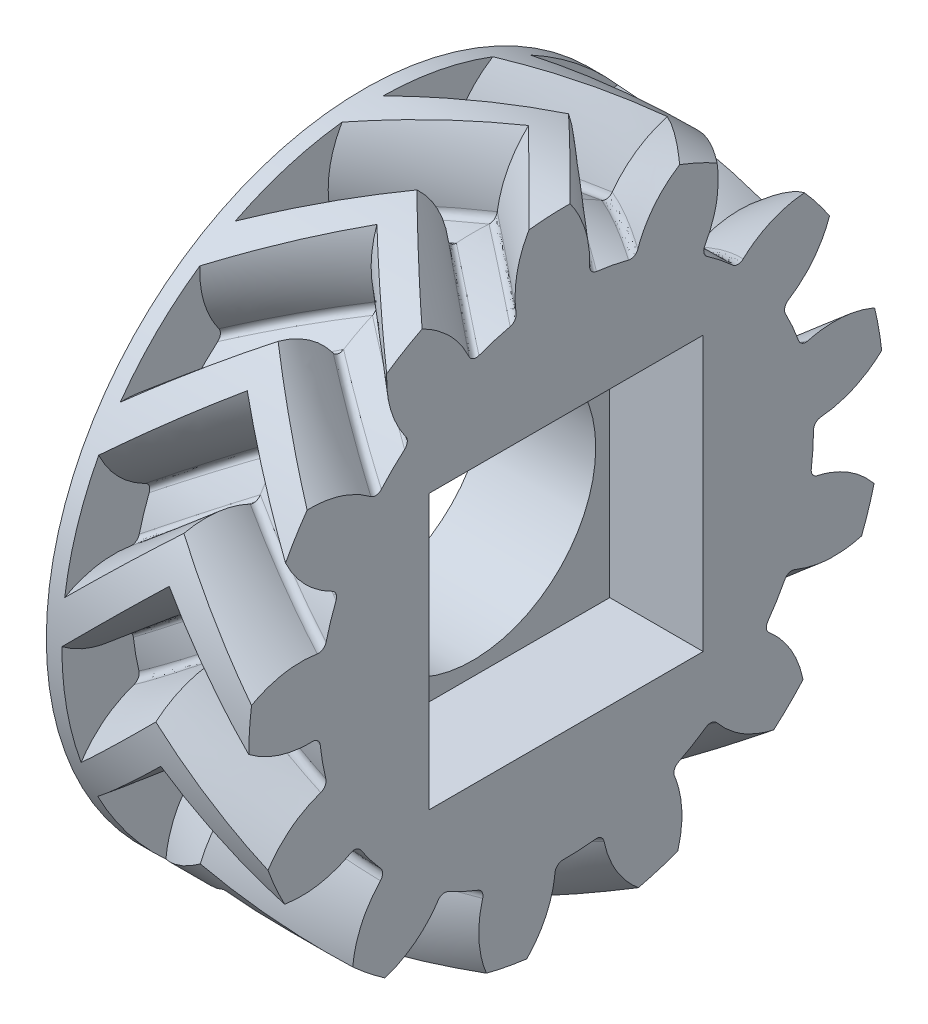
from build123d import *

# Parameters (mm, degrees)
BASPROSKE_W            = 3
BASPROSKE_H            = 10.192388155
TOOTHCUTRH_PITCH       = 64.040663503
TOOTHCUTRH_HEIGHT      = 3
TOOTHCUTRH_RADIUS      = 10.192388155
TOOTHCUTRH_START_ANGLE = -90
TEETHCUTSRH_COUNT      = 13
TEETHCUTSRH_ANGLE      = 332.307692308
BORSKE_R               = 2.4
BORE_DEPTH             = 62.5000025
SKETCH_1_R             = 3.95
CUT_EXTRUDE_1_DEPTH    = 16.613121341
SKETCH_3_W             = 8.8
SKETCH_3_H             = 8.8
CUT_EXTRUDE_2_DEPTH    = 3
SKETCH_4_R             = 10.192388155
SKETCH_4_R_2           = 3.95
EXTRUDE_1_DEPTH        = 0.5


with BuildPart() as part:
    # BasProSke → Base-Revolve (revolve)
    with BuildSketch(Plane(origin=(0, 0, 0), x_dir=(1, 0, 0), z_dir=(0, 1, 0)), mode=Mode.PRIVATE) as base_revolve_sk:
        with Locations((1.5, 5.096194078)):
            Rectangle(BASPROSKE_W, BASPROSKE_H)
    revolve(base_revolve_sk.sketch.rotate(Axis((-10, 0, 0), (1, 0, 0)), 180), axis=Axis((-10, 0, 0), (1, 0, 0)))

    # ToothCutRH: sweep along a helix
    with BuildLine() as toothcutrh_path:
        add(Helix(TOOTHCUTRH_PITCH, TOOTHCUTRH_HEIGHT, TOOTHCUTRH_RADIUS, center=(0, 0, 0), direction=(1, 0, 0), mode=Mode.PRIVATE).rotate(Axis((0, 0, 0), (1, 0, 0)), TOOTHCUTRH_START_ANGLE))
    # TooCutSkeRH → ToothCutRH (sweep, cut)
    with BuildSketch(Plane(origin=(0, 0, 0), x_dir=(0, 0, -1), z_dir=(1, 0, 0))):
        with BuildLine():
            ThreePointArc((0.523123318, 7.92514174), (0, 7.942388155), (-0.523123318, 7.92514174))
            ThreePointArc((-0.523123318, 7.92514174), (-0.696914518, 7.979968083), (-0.787810721, 8.137914875))
            ThreePointArc((-0.787810721, 8.137914875), (-1.227460211, 9.34413994), (-2.099915116, 10.285996096))
            ThreePointArc((-2.099915116, 10.285996096), (0, 10.4981598), (2.099915116, 10.285996096))
            ThreePointArc((2.099915116, 10.285996096), (1.227460211, 9.34413994), (0.787810721, 8.137914875))
            ThreePointArc((0.787810721, 8.137914875), (0.696914518, 7.979968083), (0.523123318, 7.92514174))
        make_face()
    toothcutrh = sweep(path=toothcutrh_path.line, is_frenet=True, mode=Mode.SUBTRACT)

    # TeethCutsRH: ToothCutRH ×13 about axis
    teethcutsrh_axis = Axis((-10, 0, 0), (1, 0, 0))
    for i in range(1, TEETHCUTSRH_COUNT):
        add(toothcutrh.rotate(teethcutsrh_axis, i * TEETHCUTSRH_ANGLE / (TEETHCUTSRH_COUNT - 1)), mode=Mode.SUBTRACT)

    # BorSke → Bore (cut, symmetric)
    with BuildSketch(Plane(origin=(0, 0, 0), x_dir=(0, 0, -1), z_dir=(1, 0, 0))):
        with Locations(Location((0, 0, 0), (0, 0, 180))):
            Circle(BORSKE_R)
    extrude(amount=BORE_DEPTH, both=True, mode=Mode.SUBTRACT)

    # 鏡射1: part across plane


with BuildPart() as part_1:
    add(part.part)
    add(part.part.mirror(Plane(origin=(0, 0, 0), x_dir=(0, 0, 1), z_dir=(1, 0, 0))))

    # 草圖1 → 除料-伸長1 (cut, through all)
    with BuildSketch(Plane(origin=(3, 0, 0), x_dir=(0, 0, -1), z_dir=(1, 0, 0))):
        Circle(SKETCH_1_R)
    extrude(amount=-CUT_EXTRUDE_1_DEPTH, mode=Mode.SUBTRACT)

    # 草圖3 → 除料-伸長2 (cut)
    with BuildSketch(Plane(origin=(3, 0, 0), x_dir=(0, 0, -1), z_dir=(1, 0, 0))):
        Rectangle(SKETCH_3_W, SKETCH_3_H)
    extrude(amount=-CUT_EXTRUDE_2_DEPTH, mode=Mode.SUBTRACT)

    # 草圖4 → 填料-伸長1 (add)
    with BuildSketch(Plane.ZY.offset(3)):
        Circle(SKETCH_4_R)
        with Locations(Location((0, 0, 0), (0, 0, 180))):
            Circle(SKETCH_4_R_2, mode=Mode.SUBTRACT)
    extrude(amount=EXTRUDE_1_DEPTH)


solid = part_1.part
